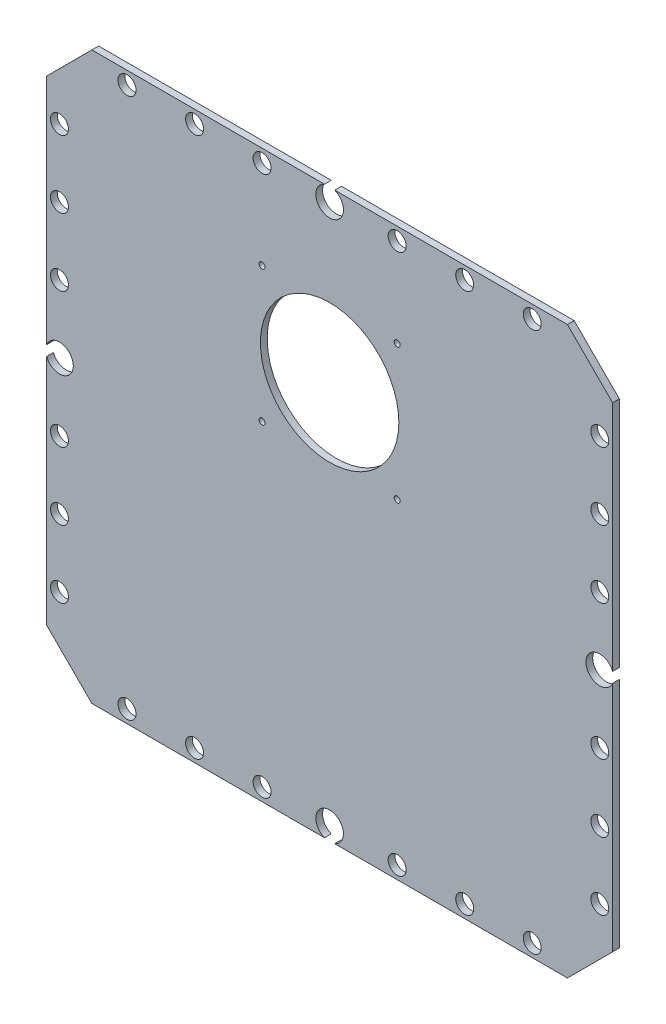
from build123d import *

# Parameters (mm, degrees)
SKETCH1_R             = 3.379999993
SKETCH1_R_2           = 3.379999996
SKETCH1_R_3           = 3.379999998
SKETCH1_R_4           = 1.13
SKETCH1_R_5           = 3.38
SKETCH1_R_6           = 26.035
BOSS_EXTRUDE1_DEPTH   = 2.54
F_4_40_TAPPED_HOLE1_D = 2.2606


with BuildPart() as part:
    # Sketch1 → Boss-Extrude1 (new body)
    with BuildSketch(Plane.XY):
        with BuildLine():
            Line((104.504938712, 0), (16.997849999, 0))
            Line((16.997849999, 0), (0, -16.997849999))
            Line((0, -16.997849999), (0, -104.504938718))
            ThreePointArc((0, -104.504938718), (5.804023687, -101.32460587), (10.020299993, -106.426000003))
            ThreePointArc((10.020299993, -106.426000003), (5.804023687, -111.527394136), (0, -108.347061288))
            Line((0, -108.347061288), (0, -195.854150007))
            Line((0, -195.854150007), (16.997849999, -212.852000007))
            Line((16.997849999, -212.852000007), (104.50493873, -212.852000007))
            ThreePointArc((104.50493873, -212.852000007), (103.510336793, -203.727202444), (111.620299993, -208.026000005))
            ThreePointArc((111.620299993, -208.026000005), (110.724797562, -210.941663213), (108.34706127, -212.852000007))
            Line((108.34706127, -212.852000007), (195.854150007, -212.852000007))
            Line((195.854150007, -212.852000007), (212.852000007, -195.854150007))
            Line((212.852000007, -195.854150007), (212.852000007, -108.347061276))
            ThreePointArc((212.852000007, -108.347061276), (202.831700005, -106.426000003), (212.852000007, -104.50493873))
            Line((212.852000007, -104.50493873), (212.852000007, -16.997849999))
            Line((212.852000007, -16.997849999), (195.854150007, 0))
            Line((195.854150007, 0), (108.347061288, 0))
            ThreePointArc((108.347061288, 0), (110.724797572, -1.910336797), (111.620299999, -4.826000001))
            ThreePointArc((111.620299999, -4.826000001), (103.510336796, -9.124797573), (104.504938712, 0))
        make_face()
        with Locations((30.226, -208.026000005)):
            Circle(SKETCH1_R, mode=Mode.SUBTRACT)
        with Locations((4.825999998, -182.626000003)):
            Circle(SKETCH1_R_2, mode=Mode.SUBTRACT)
        with Locations((55.626, -208.026000005)):
            Circle(SKETCH1_R, mode=Mode.SUBTRACT)
        with Locations((81.026, -208.026000005)):
            Circle(SKETCH1_R, mode=Mode.SUBTRACT)
        with Locations((4.825999998, -157.226000003)):
            Circle(SKETCH1_R_2, mode=Mode.SUBTRACT)
        with Locations((4.825999998, -131.826000003)):
            Circle(SKETCH1_R_2, mode=Mode.SUBTRACT)
        with Locations((131.826, -208.026000005)):
            Circle(SKETCH1_R, mode=Mode.SUBTRACT)
        with Locations((157.226, -208.026000005)):
            Circle(SKETCH1_R, mode=Mode.SUBTRACT)
        with Locations((182.626, -208.026000005)):
            Circle(SKETCH1_R, mode=Mode.SUBTRACT)
        with Locations((208.026000002, -182.626000003)):
            Circle(SKETCH1_R_3, mode=Mode.SUBTRACT)
        with Locations((208.026000002, -157.226000003)):
            Circle(SKETCH1_R_3, mode=Mode.SUBTRACT)
        with Locations((208.026000002, -131.826000003)):
            Circle(SKETCH1_R_3, mode=Mode.SUBTRACT)
        with Locations((4.825999998, -81.026000003)):
            Circle(SKETCH1_R_2, mode=Mode.SUBTRACT)
        with Locations((4.825999998, -55.626000003)):
            Circle(SKETCH1_R_2, mode=Mode.SUBTRACT)
        with Locations((81.026000003, -89.00415)):
            Circle(SKETCH1_R_4, mode=Mode.SUBTRACT)
        with Locations((4.825999998, -30.226000003)):
            Circle(SKETCH1_R_2, mode=Mode.SUBTRACT)
        with Locations((30.226, -4.826000001)):
            Circle(SKETCH1_R_5, mode=Mode.SUBTRACT)
        with Locations((81.026000003, -38.20415)):
            Circle(SKETCH1_R_4, mode=Mode.SUBTRACT)
        with Locations((55.626, -4.826000001)):
            Circle(SKETCH1_R_5, mode=Mode.SUBTRACT)
        with Locations((81.026, -4.826000001)):
            Circle(SKETCH1_R_5, mode=Mode.SUBTRACT)
        with Locations((131.826000003, -89.00415)):
            Circle(SKETCH1_R_4, mode=Mode.SUBTRACT)
        with Locations((106.426000003, -63.60415)):
            Circle(SKETCH1_R_6, mode=Mode.SUBTRACT)
        with Locations((208.026000002, -81.026000003)):
            Circle(SKETCH1_R_3, mode=Mode.SUBTRACT)
        with Locations((208.026000002, -55.626000003)):
            Circle(SKETCH1_R_3, mode=Mode.SUBTRACT)
        with Locations((131.826000003, -38.20415)):
            Circle(SKETCH1_R_4, mode=Mode.SUBTRACT)
        with Locations((131.826, -4.826000001)):
            Circle(SKETCH1_R_5, mode=Mode.SUBTRACT)
        with Locations((157.226, -4.826000001)):
            Circle(SKETCH1_R_5, mode=Mode.SUBTRACT)
        with Locations((208.026000002, -30.226000003)):
            Circle(SKETCH1_R_3, mode=Mode.SUBTRACT)
        with Locations((182.626, -4.826000001)):
            Circle(SKETCH1_R_5, mode=Mode.SUBTRACT)
    extrude(amount=BOSS_EXTRUDE1_DEPTH)

    # #4-40 Tapped Hole1 (through all)
    with Locations(Plane(origin=(81.026000003, -38.20415, 2.54), x_dir=(1, 0, 0), z_dir=(0, 0, 1))):
        with Locations((0, 0), (50.8, 0), (50.8, -50.8), (0, -50.8)):
            Hole(F_4_40_TAPPED_HOLE1_D / 2)


solid = part.part
